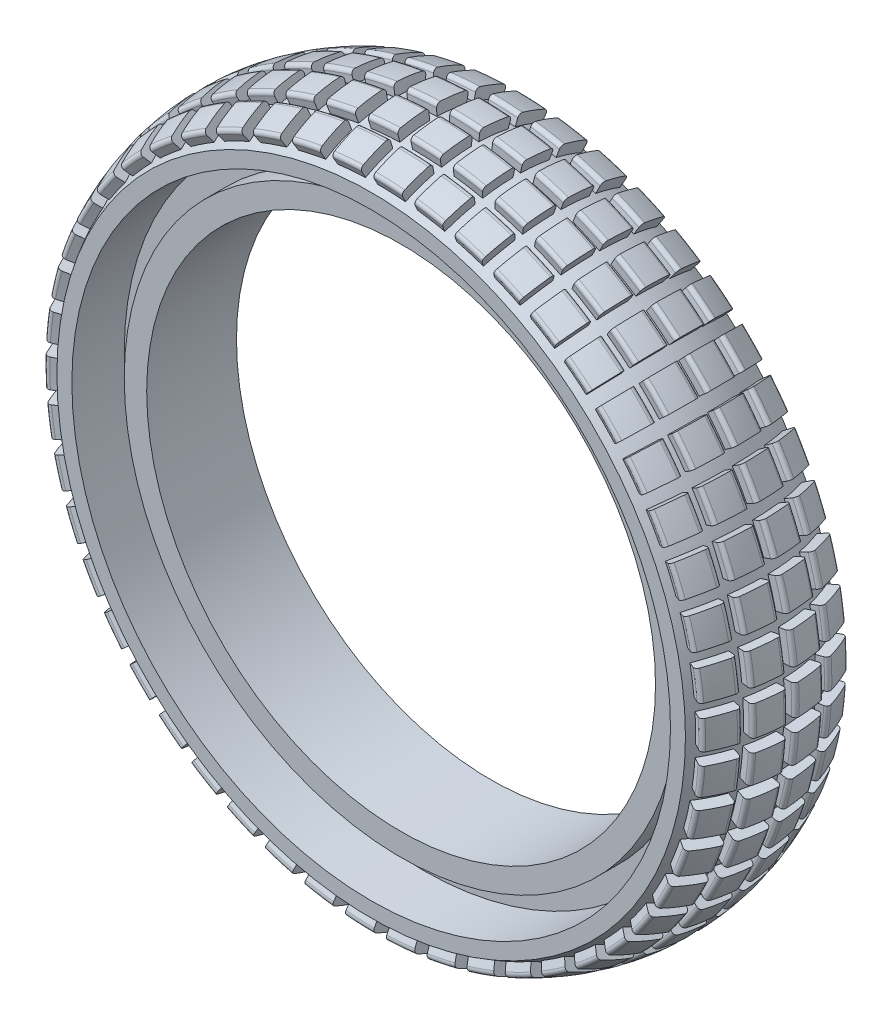
from build123d import *

# Parameters (mm, degrees)
REVOLVE2_ANGLE    = 5
CIRPATTERN1_COUNT = 50


with BuildPart() as part:
    # Sketch1 → Revolve1 (revolve)
    with BuildSketch(Plane(origin=(0, 0, 0), x_dir=(0, 0, -1), z_dir=(1, 0, 0))):
        with BuildLine():
            Line((0, 0), (0, 1.5))
            Line((0, 1.5), (1.5, 1.5))
            Line((1.5, 1.5), (1.5, 3))
            Line((1.5, 3), (-2, 3))
            Line((-2, 3), (-2, 4))
            ThreePointArc((-2, 4), (3, 5.355411069), (8, 4))
            Line((8, 4), (8, 3))
            Line((8, 3), (4.5, 3))
            Line((4.5, 3), (4.5, 1.5))
            Line((4.5, 1.5), (6, 1.5))
            Line((6, 1.5), (6, 0))
            Line((6, 0), (0, 0))
        make_face()
    revolve(axis=Axis((0, -17, -6), (0, 0, 1)))

    # Sketch2 → Revolve2 (revolve)
    with BuildSketch(Plane(origin=(0, 0, 0), x_dir=(0, 0, -1), z_dir=(1, 0, 0))):
        with BuildLine():
            Line((0.661796209, 5.585886956), (0.773551463, 5.101619513))
            ThreePointArc((0.773551463, 5.101619513), (1.755461583, 5.276661712), (2.75, 5.352031425))
            Line((2.75, 5.352031425), (2.75, 5.843163489))
            ThreePointArc((2.75, 5.843163489), (2.672475503, 6.02413918), (2.487982394, 6.092874476))
            ThreePointArc((2.487982394, 6.092874476), (1.667533179, 6.021515103), (0.855049571, 5.886980861))
            ThreePointArc((0.855049571, 5.886980861), (0.695001728, 5.777139989), (0.661796209, 5.585886956))
        make_face()
        with BuildLine():
            ThreePointArc((3.25, 5.352031425), (4.244538417, 5.276661712), (5.226448537, 5.101619513))
            Line((5.226448537, 5.101619513), (5.338203791, 5.585886956))
            ThreePointArc((5.338203791, 5.585886956), (5.304998272, 5.777139989), (5.144950429, 5.886980861))
            ThreePointArc((5.144950429, 5.886980861), (4.332466821, 6.021515103), (3.512017606, 6.092874476))
            ThreePointArc((3.512017606, 6.092874476), (3.327524497, 6.02413918), (3.25, 5.843163489))
            Line((3.25, 5.843163489), (3.25, 5.352031425))
        make_face()
        with BuildLine():
            ThreePointArc((5.710649783, 4.976923265), (6.654966621, 4.65590463), (7.562196617, 4.241512313))
            Line((7.562196617, 4.241512313), (7.791193348, 4.68260719))
            ThreePointArc((7.791193348, 4.68260719), (7.806734112, 4.876098311), (7.679136871, 5.022383216))
            ThreePointArc((7.679136871, 5.022383216), (6.927082532, 5.354815975), (6.151625528, 5.628245496))
            ThreePointArc((6.151625528, 5.628245496), (5.956350072, 5.608038764), (5.83587673, 5.453032346))
            Line((5.83587673, 5.453032346), (5.710649783, 4.976923265))
        make_face()
        with BuildLine():
            Line((-1.791193348, 4.68260719), (-1.562196617, 4.241512313))
            ThreePointArc((-1.562196617, 4.241512313), (-0.654966621, 4.65590463), (0.289350217, 4.976923265))
            Line((0.289350217, 4.976923265), (0.16412327, 5.453032346))
            ThreePointArc((0.16412327, 5.453032346), (0.043649928, 5.608038764), (-0.151625528, 5.628245496))
            ThreePointArc((-0.151625528, 5.628245496), (-0.927082532, 5.354815975), (-1.679136871, 5.022383216))
            ThreePointArc((-1.679136871, 5.022383216), (-1.806734112, 4.876098311), (-1.791193348, 4.68260719))
        make_face()
    revolve2 = revolve(axis=Axis((0, -17, 0), (0, 0, -1)), revolution_arc=REVOLVE2_ANGLE)

    # CirPattern1: Revolve2 ×50 about axis
    cirpattern1_axis = Axis((0, -17, 0), (0, 0, -1))
    for i in range(1, CIRPATTERN1_COUNT):
        add(revolve2.rotate(cirpattern1_axis, i * 360 / CIRPATTERN1_COUNT))


solid = part.part
